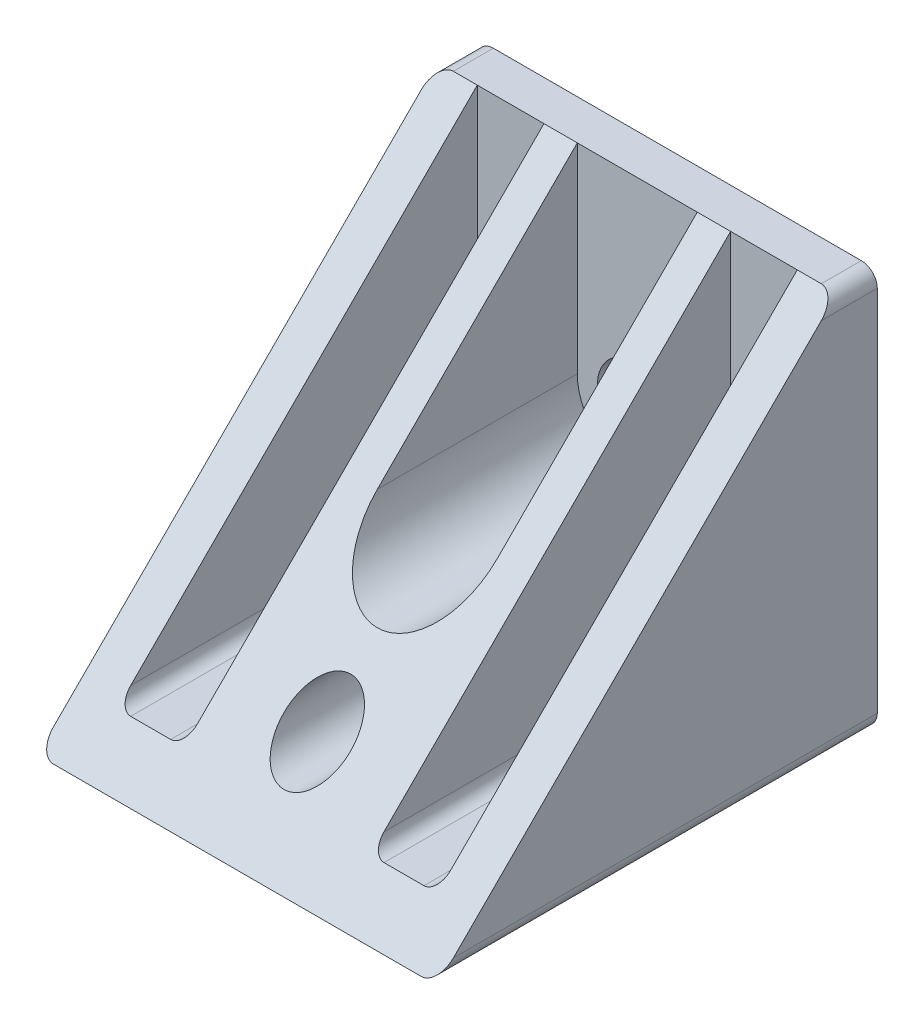
from build123d import *

# Parameters (mm, degrees)
EXTRUDE_1_DEPTH     = 30
SKETCH_2_W          = 5
SKETCH_2_H          = 54
CUT_EXTRUDE_1_DEPTH = 45
FILLET_1_R          = 1
SKETCH_4_R          = 3
CUT_EXTRUDE_2_DEPTH = 45
SKETCH_5_R          = 2.5
CUT_EXTRUDE_3_DEPTH = 92
FILLET_2_R          = 1.2


with BuildPart() as part:
    # 草图1 → 凸台-拉伸1 (new body)
    with BuildSketch(Plane(origin=(0, 0, 0), x_dir=(0, 0, -1), z_dir=(1, 0, 0))):
        Polygon((0, 30), (0, 0), (-33, 0), (-3, 30), align=None)
    extrude(amount=EXTRUDE_1_DEPTH)

    # 草图2 → 切除-拉伸1 (cut)
    with BuildSketch(Plane(origin=(0, 0, 3), x_dir=(-1, 0, 0), z_dir=(0, 0, -1))):
        with BuildLine():
            Line((-19.5, 15), (-19.5, 31.772972214))
            ThreePointArc((-19.5, 31.772972214), (-15, 36.272972214), (-10.5, 31.772972214))
            Line((-10.5, 31.772972214), (-10.5, 15))
            ThreePointArc((-10.5, 15), (-15, 10.5), (-19.5, 15))
        make_face()
        with Locations((-5.5, 30)):
            Rectangle(SKETCH_2_W, SKETCH_2_H)
        with Locations((-24.5, 30)):
            Rectangle(SKETCH_2_W, SKETCH_2_H)
    extrude(amount=-CUT_EXTRUDE_1_DEPTH, mode=Mode.SUBTRACT)

    # 圆角1
    fillet_1_edges = [part.edges().sort_by_distance(p)[0] for p in [
        (8, 3, 16.5),
        (3, 3, 16.5),
        (22, 3, 16.5),
        (27, 3, 16.5),
    ]]
    fillet(fillet_1_edges, radius=FILLET_1_R)

    # 草图4 → 切除-拉伸2 (cut)
    with BuildSketch(Plane.XY.offset(3)):
        with Locations((15, 15)):
            Circle(SKETCH_4_R)
    extrude(amount=-CUT_EXTRUDE_2_DEPTH, mode=Mode.SUBTRACT)

    # 草图5 → 切除-拉伸3 (cut)
    with BuildSketch(Plane.XY):
        with Locations((15, 6)):
            Circle(SKETCH_5_R)
    extrude(amount=CUT_EXTRUDE_3_DEPTH, mode=Mode.SUBTRACT)

    # 圆角2
    fillet_2_edges = [part.edges().sort_by_distance(p)[0] for p in [
        (30, 30, 1.5),
        (30, 0, 16.5),
        (0, 0, 16.5),
        (0, 30, 1.5),
    ]]
    fillet(fillet_2_edges, radius=FILLET_2_R)


solid = part.part
